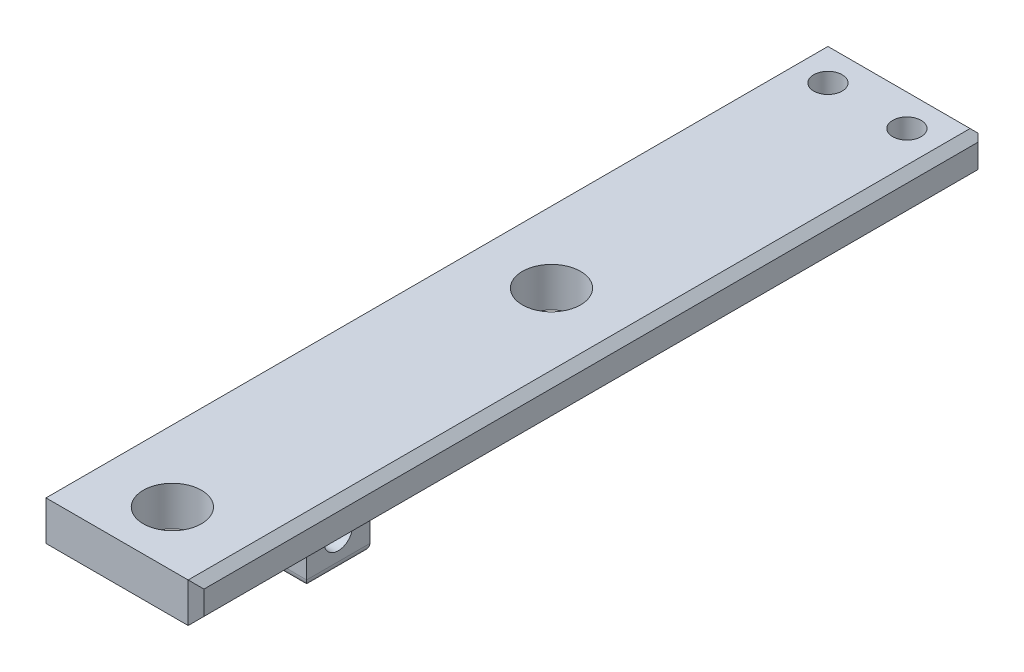
from build123d import *

# Parameters (mm, degrees)
SKETCH1_W               = 20
SKETCH1_H               = 100
BOSS_EXTRUDE1_DEPTH     = 5
M3_CLEARANCE_HOLE1_D    = 3.6
SKETCH3_W               = 8
SKETCH3_H               = 8
BOSS_EXTRUDE2_DEPTH     = 8.5
M3_CLEARANCE_HOLE5_D    = 3.6
E_0_29_DIAMETER_HOLE2_D = 7.366
CHAMFER1_SIZE           = 1
E_0_29_DIAMETER_HOLE1_D = 7.366
FILLET3_R               = 1
CHAMFER2_SIZE           = 1
M3_CLEARANCE_HOLE6_D    = 3.6


with BuildPart() as part:
    # Sketch1 → Boss-Extrude1 (new body)
    with BuildSketch(Plane(origin=(0, 0, 0), x_dir=(1, 0, 0), z_dir=(0, 1, 0))):
        with Locations((10, 50)):
            Rectangle(SKETCH1_W, SKETCH1_H)
    extrude(amount=BOSS_EXTRUDE1_DEPTH)

    # M3 Clearance Hole1 (through all)
    with Locations(Plane(origin=(15, 0, -95), x_dir=(0, 0, -1), z_dir=(0, -1, 0))):
        with Locations((0, 0)):
            Hole(M3_CLEARANCE_HOLE1_D / 2)

    # Sketch3 → Boss-Extrude2 (add)
    with BuildSketch(Plane.XZ):
        with Locations((10, -24)):
            Rectangle(SKETCH3_W, SKETCH3_H)
    extrude(amount=BOSS_EXTRUDE2_DEPTH)

    # M3 Clearance Hole5 (through all)
    with Locations(Plane(origin=(6, -4.5, -24), x_dir=(0, 0, -1), z_dir=(-1, 0, 0))):
        with Locations((0, 0)):
            Hole(M3_CLEARANCE_HOLE5_D / 2)

    # E (0.29) Diameter Hole2 (through all)
    with Locations(Plane(origin=(10, 0, -55), x_dir=(0, 0, -1), z_dir=(0, -1, 0))):
        with Locations((0, 0)):
            Hole(E_0_29_DIAMETER_HOLE2_D / 2)

    # Chamfer1
    chamfer1_edges = [part.edges().sort_by_distance(p)[0] for p in [
        (20, 2.5, -100),
        (20, 0, -50),
        (20, 5, -50),
        (0, 0, -50),
        (0, 2.5, -100),
        (0, 5, -50),
        (20, 2.5, 0),
        (0, 2.5, 0),
    ]]
    chamfer(chamfer1_edges, length=CHAMFER1_SIZE)

    # E (0.29) Diameter Hole1 (through all)
    with Locations(Plane(origin=(10, 0, -7), x_dir=(0, 0, -1), z_dir=(0, -1, 0))):
        with Locations((0, 0)):
            Hole(E_0_29_DIAMETER_HOLE1_D / 2)

    # Fillet3
    fillet3_edges = [part.edges().sort_by_distance(p)[0] for p in [
        (10, -8.5, -28),
        (6, -8.5, -24),
        (10, -8.5, -20),
        (14, -8.5, -24),
    ]]
    fillet(fillet3_edges, radius=FILLET3_R)

    # Chamfer2
    chamfer2_edges = [part.edges().sort_by_distance(p)[0] for p in [
        (10, 5, -100),
        (10, 0, -100),
    ]]
    chamfer(chamfer2_edges, length=CHAMFER2_SIZE)

    # M3 Clearance Hole6 (through all)
    with Locations(Plane(origin=(5, 0, -95), x_dir=(0, 0, -1), z_dir=(0, -1, 0))):
        with Locations((0, 0)):
            Hole(M3_CLEARANCE_HOLE6_D / 2)


solid = part.part
